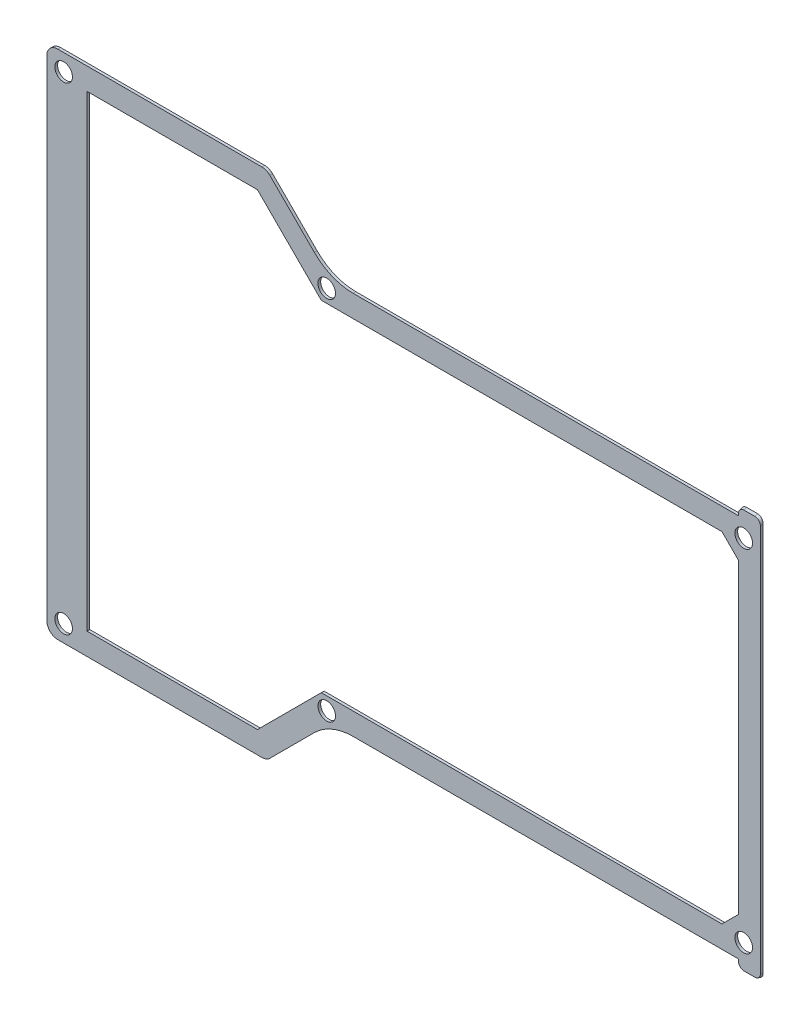
from build123d import *

# Parameters (mm, degrees)
SKETCH1_R           = 1.6
BOSS_EXTRUDE1_DEPTH = 0.5
CUT_EXTRUDE3_DEPTH  = 10
FILLET1_R           = 1
SKETCH3_W           = 11
SKETCH3_H           = 85
CUT_EXTRUDE4_DEPTH  = 10


with BuildPart() as part:
    # Sketch1 → Boss-Extrude1 (new body)
    with BuildSketch(Plane.XY):
        with BuildLine():
            ThreePointArc((37.403989873, -22.874599188), (33.57715555, -22.113394513), (30.332922061, -19.945667))
            Line((30.332922061, -19.945667), (22.242640687, -11.855385626))
            ThreePointArc((22.242640687, -11.855385626), (21.593793989, -11.421840123), (20.828427125, -11.269599188))
            Line((20.828427125, -11.269599188), (-16.3, -11.269599188))
            ThreePointArc((-16.3, -11.269599188), (-17.714213562, -11.855385626), (-18.3, -13.269599188))
            Line((-18.3, -13.269599188), (-18.3, -102.269599188))
            ThreePointArc((-18.3, -102.269599188), (-17.714213562, -103.68381275), (-16.3, -104.269599188))
            Line((-16.3, -104.269599188), (20.828427125, -104.269599188))
            ThreePointArc((20.828427125, -104.269599188), (21.593793989, -104.117358253), (22.242640687, -103.68381275))
            Line((22.242640687, -103.68381275), (30.337922061, -95.588531376))
            ThreePointArc((30.337922061, -95.588531376), (33.58215555, -93.420803863), (37.408989873, -92.659599188))
            Line((37.408989873, -92.659599188), (107.455, -92.659599188))
            Line((107.455, -92.659599188), (107.455, -94.229460967))
            Line((107.455, -94.229460967), (111.455, -94.229460967))
            Line((111.455, -94.229460967), (111.455, -21.305413491))
            Line((111.455, -21.305413491), (110.455, -21.305413491))
            Line((110.455, -21.305413491), (108.455, -21.305413491))
            Line((108.455, -21.305413491), (107.455, -21.305413491))
            Line((107.455, -21.305413491), (107.455, -22.874599188))
            Line((107.455, -22.874599188), (37.403989873, -22.874599188))
        make_face()
        with Locations((-15.239339828, -101.208939016)):
            Circle(SKETCH1_R, mode=Mode.SUBTRACT)
        with Locations((32.596077775, -91.040201526)):
            Circle(SKETCH1_R, mode=Mode.SUBTRACT)
        with Locations((108.412106781, -89.616705969)):
            Circle(SKETCH1_R, mode=Mode.SUBTRACT)
        with Locations((-15.239339828, -14.33025936)):
            Circle(SKETCH1_R, mode=Mode.SUBTRACT)
        with Locations((32.591077775, -24.493996851)):
            Circle(SKETCH1_R, mode=Mode.SUBTRACT)
        Polygon((31.61, -88.659599188), (20, -100.269599188), (0, -100.269599188), (0, -15.269599188), (20, -15.269599188), (31.605, -26.874599188), (104.455, -26.874599188), (107.455, -29.874599188), (107.455, -85.659599188), (104.455, -88.659599188), align=None, mode=Mode.SUBTRACT)
        with Locations((108.412106781, -25.917492407)):
            Circle(SKETCH1_R, mode=Mode.SUBTRACT)
    extrude(amount=BOSS_EXTRUDE1_DEPTH)

    # Sketch2 → Cut-Extrude3 (cut)
    with BuildSketch(Plane(origin=(111.455, 0, 0), x_dir=(0, 0, -1), z_dir=(1, 0, 0))):
        Polygon((-2.509224917, -22.180400125), (0, -21.305413491), (1.866342624, -18.933308689), (-2.23434161, -18.933308689), align=None)
        Polygon((4.266625508, -98.662833417), (0, -94.229460967), (-3.714378177, -92.933669782), (-3.714378177, -98.662833417), align=None)
    extrude(amount=-CUT_EXTRUDE3_DEPTH, mode=Mode.SUBTRACT)

    # Fillet1
    fillet1_edges = [part.edges().sort_by_distance(p)[0] for p in [
        (107.455, -94.142246424, 0.25),
        (111.455, -94.142246424, 0.25),
        (107.455, -21.392590474, 0.25),
        (111.455, -21.392590474, 0.25),
    ]]
    fillet(fillet1_edges, radius=FILLET1_R)

    # Sketch3 → Cut-Extrude4 (cut)
    with BuildSketch(Plane.XY.offset(0.5)):
        with Locations((-5.5, -57.769599188)):
            Rectangle(SKETCH3_W, SKETCH3_H)
    extrude(amount=-CUT_EXTRUDE4_DEPTH, mode=Mode.SUBTRACT)


solid = part.part
